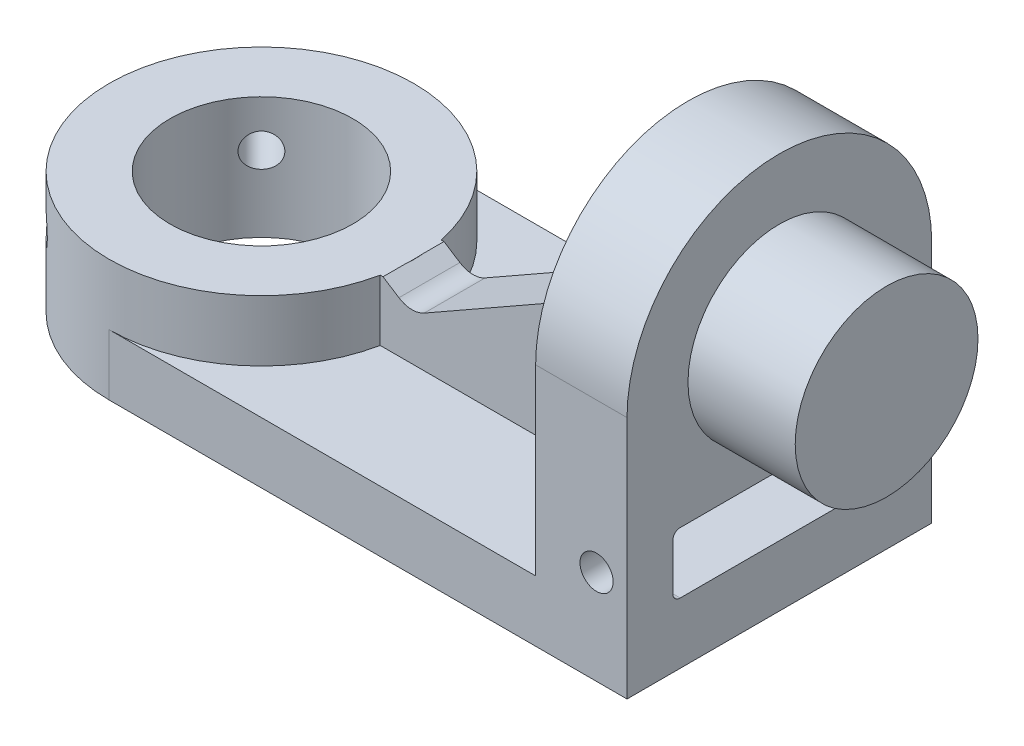
from build123d import *

# Parameters (mm, degrees)
SKETCH1_R               = 15.875
SKETCH1_R_2             = 9.525
BOSS_EXTRUDE1_DEPTH     = 12.7
SKETCH10_R              = 1.7272
CUT_EXTRUDE3_DEPTH      = 12.7
SKETCH5_R               = 1.7272
CUT_EXTRUDE4_DEPTH      = 12.7
BOSS_EXTRUDE6_DEPTH     = 6.35
SKETCH1_9_W             = 9.525
SKETCH1_9_H             = 31.75
BOSS_EXTRUDE7_DEPTH     = 25.4
RIB18_START             = -3.175
RIB18_DEPTH             = 6.35
CUT_EXTRUDE5_DEPTH      = 8.001
BOSS_EXTRUDE8_DEPTH     = 9.525
BOSS_EXTRUDE9_DEPTH     = 11.176
CUT_EXTRUDE6_DEPTH      = 44.196
CUT_EXTRUDE6_DEPTH_BACK = 50.8
SKETCH22_R              = 1.7272


with BuildPart() as part:
    # Sketch1 → Boss-Extrude1 (new body)
    with BuildSketch(Plane(origin=(0, 0, 0), x_dir=(1, 0, 0), z_dir=(0, 1, 0))):
        with Locations(Location((0, 0, 0), (0, 0, 270))):
            Circle(SKETCH1_R)
        with Locations(Location((0, 0, 0), (0, 0, 270))):
            Circle(SKETCH1_R_2, mode=Mode.SUBTRACT)
    extrude(amount=BOSS_EXTRUDE1_DEPTH)

    # Sketch10 → Cut-Extrude3 (cut)
    with BuildSketch(Plane(origin=(-11.225320151, 0, -11.225320151), x_dir=(-0.7071067811865486, 0, 0.7071067811865465), z_dir=(-0.7071067811865465, 0, -0.7071067811865486))):
        with Locations((0, 7.874)):
            Circle(SKETCH10_R)
    extrude(amount=-CUT_EXTRUDE3_DEPTH, mode=Mode.SUBTRACT)

    # Sketch5 → Cut-Extrude4 (cut)
    with BuildSketch(Plane(origin=(-11.225320151, 0, 11.225320151), x_dir=(0.7071067811865488, 0, 0.7071067811865464), z_dir=(-0.7071067811865464, 0, 0.7071067811865488))):
        with Locations((0, 7.874)):
            Circle(SKETCH5_R)
    extrude(amount=-CUT_EXTRUDE4_DEPTH, mode=Mode.SUBTRACT)

    # Sketch1<8> → Boss-Extrude6 (add)
    with BuildSketch(Plane(origin=(0, 0, 0), x_dir=(1, 0, 0), z_dir=(0, 1, 0))):
        with BuildLine():
            Line((0, -15.875), (15.875, -15.875))
            Line((15.875, -15.875), (15.875, 0))
            ThreePointArc((15.875, 0), (11.225320151, -11.225320151), (0, -15.875))
        make_face()
        with BuildLine():
            Line((15.875, 0), (15.875, 15.875))
            Line((15.875, 15.875), (0, 15.875))
            ThreePointArc((0, 15.875), (11.225320151, 11.225320151), (15.875, 0))
        make_face()
        Polygon((44.45, -15.875), (44.45, 15.875), (15.875, 15.875), (15.875, 0), (15.875, -15.875), align=None)
    extrude(amount=BOSS_EXTRUDE6_DEPTH)

    # Sketch1<9> → Boss-Extrude7 (add)
    with BuildSketch(Plane(origin=(0, 0, 0), x_dir=(1, 0, 0), z_dir=(0, 1, 0))):
        with Locations((49.2125, 0)):
            Rectangle(SKETCH1_9_W, SKETCH1_9_H)
    extrude(amount=BOSS_EXTRUDE7_DEPTH)

    # Rib18: read off the stored shape, not the designer's step
    # Rib18 outline → Rib18 (add)
    with BuildSketch(Plane.XY.offset(RIB18_START)):
        with BuildLine():
            Line((15.847686346, 12.7), (15.554259867, 12.7))
            Line((15.554259867, 12.7), (15.554259867, 6.35))
            Line((15.554259867, 6.35), (44.45, 6.35))
            Line((44.45, 6.35), (44.45, 25.4))
            Line((44.45, 25.4), (20.13457386, 11.562910878))
            ThreePointArc((20.13457386, 11.562910878), (18.809330508, 11.231428329), (17.504040967, 11.634379737))
            Line((17.504040967, 11.634379737), (15.847686346, 12.7))
        make_face()
    extrude(amount=RIB18_DEPTH)

    # Sketch20 → Cut-Extrude5 (cut)
    with BuildSketch(Plane(origin=(53.975, 0, 0), x_dir=(0, 0, -1), z_dir=(1, 0, 0))):
        with BuildLine():
            ThreePointArc((-10.3378, 6.35), (-10.876615367, 6.573184633), (-11.0998, 7.112))
            Line((-11.0998, 7.112), (-11.0998, 11.938))
            ThreePointArc((-11.0998, 11.938), (-10.876615367, 12.476815367), (-10.3378, 12.7))
            Line((-10.3378, 12.7), (10.3378, 12.7))
            ThreePointArc((10.3378, 12.7), (10.876615367, 12.476815367), (11.0998, 11.938))
            Line((11.0998, 11.938), (11.0998, 7.112))
            ThreePointArc((11.0998, 7.112), (10.876615367, 6.573184633), (10.3378, 6.35))
            Line((10.3378, 6.35), (-10.3378, 6.35))
        make_face()
    extrude(amount=-CUT_EXTRUDE5_DEPTH, mode=Mode.SUBTRACT)

    # Sketch20<3> → Boss-Extrude8 (add)
    with BuildSketch(Plane(origin=(53.975, 0, 0), x_dir=(0, 0, -1), z_dir=(1, 0, 0))):
        with BuildLine():
            Line((-15.875, 25.4), (-9.525, 25.4))
            ThreePointArc((-9.525, 25.4), (0, 34.925), (9.525, 25.4))
            Line((9.525, 25.4), (15.875, 25.4))
            ThreePointArc((15.875, 25.4), (0, 41.275), (-15.875, 25.4))
        make_face()
        with BuildLine():
            ThreePointArc((9.525, 25.4), (0, 34.925), (-9.525, 25.4))
            Line((-9.525, 25.4), (9.525, 25.4))
        make_face()
        with BuildLine():
            Line((9.525, 25.4), (-9.525, 25.4))
            ThreePointArc((-9.525, 25.4), (0, 15.875), (9.525, 25.4))
        make_face()
    extrude(amount=-BOSS_EXTRUDE8_DEPTH)

    # Sketch20<4> → Boss-Extrude9 (add)
    with BuildSketch(Plane(origin=(53.975, 0, 0), x_dir=(0, 0, -1), z_dir=(1, 0, 0))):
        with BuildLine():
            ThreePointArc((9.525, 25.4), (0, 34.925), (-9.525, 25.4))
            Line((-9.525, 25.4), (9.525, 25.4))
        make_face()
        with BuildLine():
            Line((9.525, 25.4), (-9.525, 25.4))
            ThreePointArc((-9.525, 25.4), (0, 15.875), (9.525, 25.4))
        make_face()
    extrude(amount=BOSS_EXTRUDE9_DEPTH)

    # Sketch22 → Cut-Extrude6 (cut, two sides: drawn at the far end of the back side and taken through both)
    with BuildSketch(Plane.XY.offset(-CUT_EXTRUDE6_DEPTH_BACK)):
        with Locations(Location((50.8, 9.850914973, 0), (0, 0, 180))):
            Circle(SKETCH22_R)
    extrude(amount=CUT_EXTRUDE6_DEPTH + CUT_EXTRUDE6_DEPTH_BACK, mode=Mode.SUBTRACT)


solid = part.part
